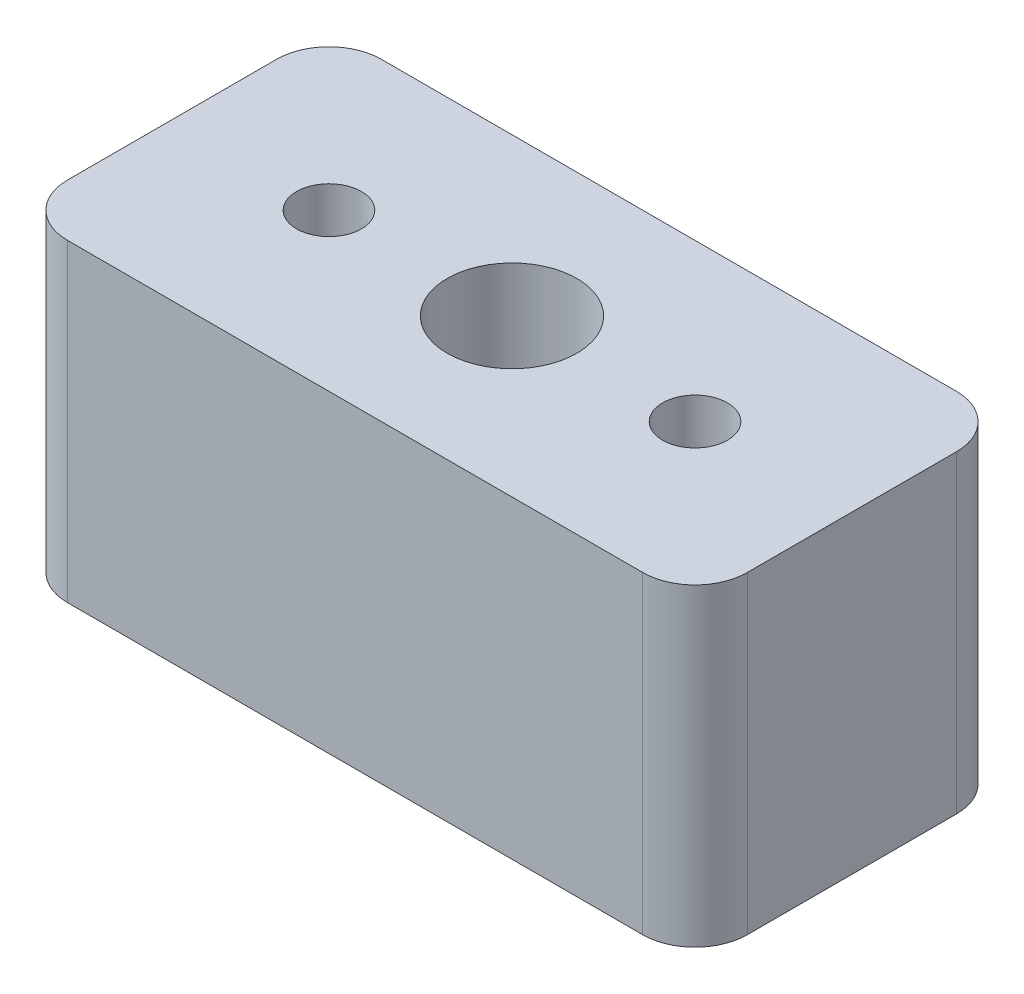
from build123d import *

# Parameters (mm, degrees)
SKETCH1_W           = 6.5
SKETCH1_H           = 3
SKETCH1_R           = 0.31
SKETCH1_R_2         = 0.62
BOSS_EXTRUDE1_DEPTH = 3
FILLET1_R           = 0.5


with BuildPart() as part:
    # Sketch1 → Boss-Extrude1 (new body)
    with BuildSketch(Plane(origin=(0, 0, 0), x_dir=(1, 0, 0), z_dir=(0, 1, 0))):
        Rectangle(SKETCH1_W, SKETCH1_H)
        with Locations((-1.75, 0)):
            Circle(SKETCH1_R, mode=Mode.SUBTRACT)
        Circle(SKETCH1_R_2, mode=Mode.SUBTRACT)
        with Locations((1.75, 0)):
            Circle(SKETCH1_R, mode=Mode.SUBTRACT)
    extrude(amount=BOSS_EXTRUDE1_DEPTH)

    # Fillet1
    fillet1_edges = [part.edges().sort_by_distance(p)[0] for p in [
        (3.25, 1.5, 1.5),
        (3.25, 1.5, -1.5),
        (-3.25, 1.5, -1.5),
        (-3.25, 1.5, 1.5),
    ]]
    fillet(fillet1_edges, radius=FILLET1_R)


solid = part.part
